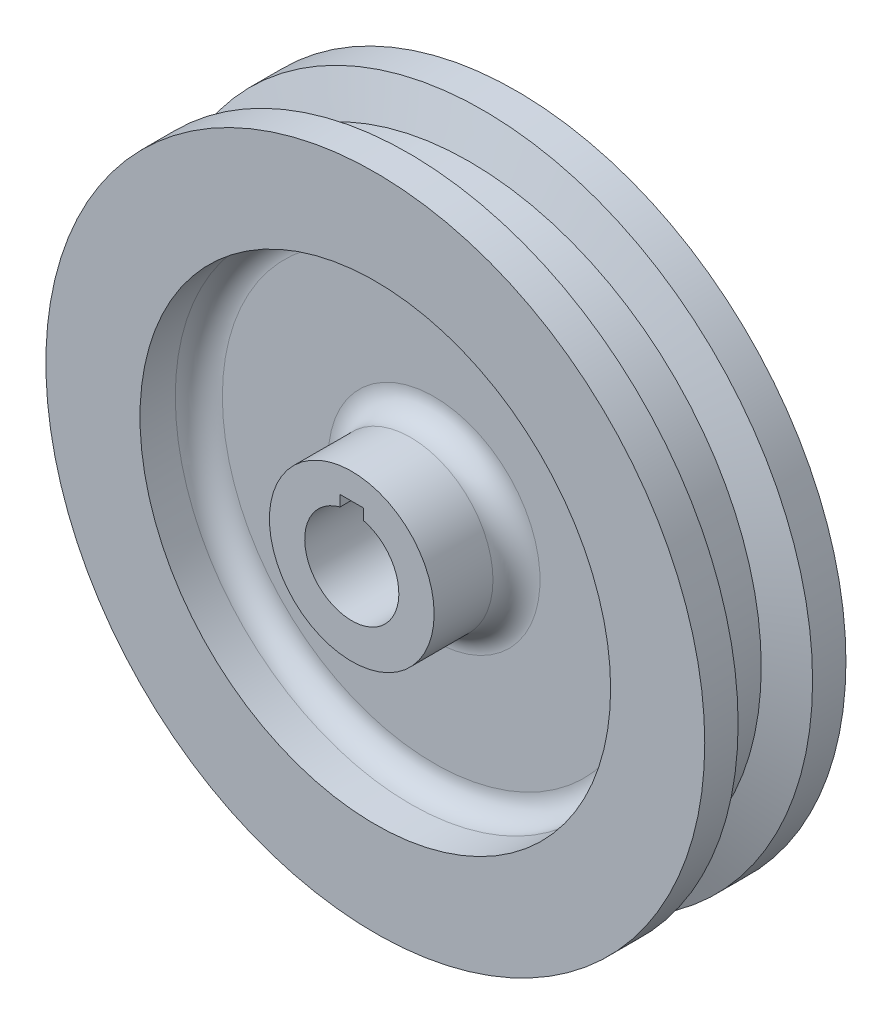
from build123d import *

# Parameters (mm, degrees)
FILLET1_R          = 6.35
SKETCH3_W          = 6.35
SKETCH3_H          = 15.24
CUT_EXTRUDE1_DEPTH = 136.598893801


with BuildPart() as part:
    # Sketch1 → Revolve2 (revolve)
    with BuildSketch(Plane(origin=(0, 0, 0), x_dir=(0, 0, -1), z_dir=(1, 0, 0))):
        Polygon((-25.4, 12.7), (25.4, 12.7), (25.4, 22.225), (3.175, 22.225), (3.175, 63.5), (19.05, 63.5), (19.05, 88.9), (-19.05, 88.9), (-19.05, 63.5), (-3.175, 63.5), (-3.175, 22.225), (-25.4, 22.225), align=None)
    revolve(axis=Axis((0, 0, 0), (0, 0, -1)))

    # Sketch2 → Cut-Revolve1 (revolve, cut)
    with BuildSketch(Plane(origin=(0, 0, 0), x_dir=(0, 0, -1), z_dir=(1, 0, 0))):
        Polygon((-10.04793758, 88.9), (-6.35, 78.74), (6.35, 78.74), (10.04793758, 88.9), align=None)
    revolve(axis=Axis((0, 0, 0), (0, 0, -1)), mode=Mode.SUBTRACT)

    # Fillet1
    fillet1_edges = [part.edges().sort_by_distance(p)[0] for p in [
        (0, -63.5, -3.175),
        (0, -22.225, -3.175),
        (0, -22.225, 3.175),
        (0, -63.5, 3.175),
    ]]
    fillet(fillet1_edges, radius=FILLET1_R)

    # Sketch3 → Cut-Extrude1 (cut, through all)
    with BuildSketch(Plane.XY.offset(25.4)):
        with Locations((0, 7.62)):
            Rectangle(SKETCH3_W, SKETCH3_H)
    extrude(amount=-CUT_EXTRUDE1_DEPTH, mode=Mode.SUBTRACT)


solid = part.part
